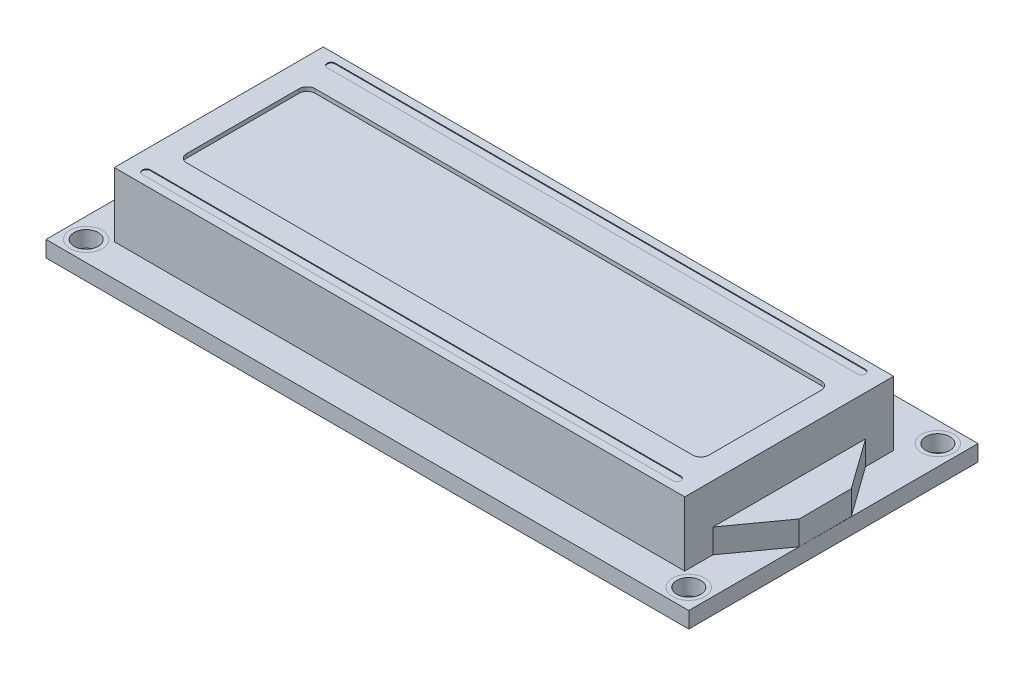
from build123d import *

# Parameters (mm, degrees)
SKETCH1_W           = 80
SKETCH1_H           = 36
BOSS_EXTRUDE1_DEPTH = 2
SKETCH2_R           = 1.5
CUT_EXTRUDE1_DEPTH  = 44.9089968
SKETCH3_W           = 71
SKETCH3_H           = 26
BOSS_EXTRUDE2_DEPTH = 8
CUT_EXTRUDE2_DEPTH  = 0.5
CUT_EXTRUDE3_DEPTH  = 0.1
BOSS_EXTRUDE3_DEPTH = 3
SKETCH10_R          = 0.5
CUT_EXTRUDE4_DEPTH  = 45.586993619


with BuildPart() as part:
    # Sketch1 → Boss-Extrude1 (new body)
    with BuildSketch(Plane(origin=(0, 0, 0), x_dir=(1, 0, 0), z_dir=(0, 1, 0))):
        Rectangle(SKETCH1_W, SKETCH1_H)
    extrude(amount=BOSS_EXTRUDE1_DEPTH)

    # Sketch2 → Cut-Extrude1 (cut, through all)
    with BuildSketch(Plane(origin=(0, 2, 0), x_dir=(1, 0, 0), z_dir=(0, 1, 0))):
        with Locations((-37.5, 15.5)):
            Circle(SKETCH2_R)
        with Locations((37.5, 15.5)):
            Circle(SKETCH2_R)
        with Locations((-37.5, -15.5)):
            Circle(SKETCH2_R)
        with Locations((37.5, -15.5)):
            Circle(SKETCH2_R)
    extrude(amount=-CUT_EXTRUDE1_DEPTH, mode=Mode.SUBTRACT)

    # Sketch3 → Boss-Extrude2 (add)
    with BuildSketch(Plane(origin=(0, 2, 0), x_dir=(1, 0, 0), z_dir=(0, 1, 0))):
        with Locations((0, -1)):
            Rectangle(SKETCH3_W, SKETCH3_H)
    extrude(amount=BOSS_EXTRUDE2_DEPTH)

    # Sketch5 → Cut-Extrude2 (cut)
    with BuildSketch(Plane(origin=(0, 10, 0), x_dir=(1, 0, 0), z_dir=(0, 1, 0))):
        with BuildLine():
            Line((-31.5, 7), (31.5, 7))
            ThreePointArc((31.5, 7), (32.207106781, 6.707106781), (32.5, 6))
            Line((32.5, 6), (32.5, -8))
            ThreePointArc((32.5, -8), (32.207106781, -8.707106781), (31.5, -9))
            Line((31.5, -9), (-31.5, -9))
            ThreePointArc((-31.5, -9), (-32.207106781, -8.707106781), (-32.5, -8))
            Line((-32.5, -8), (-32.5, 6))
            ThreePointArc((-32.5, 6), (-32.207106781, 6.707106781), (-31.5, 7))
        make_face()
    extrude(amount=-CUT_EXTRUDE2_DEPTH, mode=Mode.SUBTRACT)

    # Sketch6 → Cut-Extrude3 (cut)
    with BuildSketch(Plane(origin=(0, 10, 0), x_dir=(1, 0, 0), z_dir=(0, 1, 0))):
        with BuildLine():
            Line((33.01, 10), (-33.01, 10))
            ThreePointArc((-33.01, 10), (-33.356482323, 10.143517677), (-33.5, 10.49))
            Line((-33.5, 10.49), (-33.5, 10.51))
            ThreePointArc((-33.5, 10.51), (-33.356482323, 10.856482323), (-33.01, 11))
            Line((-33.01, 11), (33.01, 11))
            ThreePointArc((33.01, 11), (33.356482323, 10.856482323), (33.5, 10.51))
            Line((33.5, 10.51), (33.5, 10.49))
            ThreePointArc((33.5, 10.49), (33.356482323, 10.143517677), (33.01, 10))
        make_face()
        with BuildLine():
            Line((-33.5, -12.49), (-33.5, -12.51))
            ThreePointArc((-33.5, -12.51), (-33.356482323, -12.856482323), (-33.01, -13))
            Line((-33.01, -13), (33.01, -13))
            ThreePointArc((33.01, -13), (33.356482323, -12.856482323), (33.5, -12.51))
            Line((33.5, -12.51), (33.5, -12.49))
            ThreePointArc((33.5, -12.49), (33.356482323, -12.143517677), (33.01, -12))
            Line((33.01, -12), (-33.01, -12))
            ThreePointArc((-33.01, -12), (-33.356482323, -12.143517677), (-33.5, -12.49))
        make_face()
    extrude(amount=-CUT_EXTRUDE3_DEPTH, mode=Mode.SUBTRACT)

    # Sketch7 → Boss-Extrude3 (add)
    with BuildSketch(Plane(origin=(0, 2, 0), x_dir=(1, 0, 0), z_dir=(0, 1, 0))):
        Polygon((35.5, 8.5), (35.5, -10.5), (40, -4.249984615), (39.98, 2.249984615), align=None)
    extrude(amount=BOSS_EXTRUDE3_DEPTH)

    # Sketch10 → Cut-Extrude4 (cut, through all)
    with BuildSketch(Plane(origin=(0, 2, 0), x_dir=(1, 0, 0), z_dir=(0, 1, 0))):
        with Locations((-32, 16)):
            Circle(SKETCH10_R)
        with Locations((-29.5, 16)):
            Circle(SKETCH10_R)
        with Locations((-27, 16)):
            Circle(SKETCH10_R)
        with Locations((-24.5, 16)):
            Circle(SKETCH10_R)
        with Locations((-22, 16)):
            Circle(SKETCH10_R)
        with Locations((-19.5, 16)):
            Circle(SKETCH10_R)
        with Locations((-17, 16)):
            Circle(SKETCH10_R)
        with Locations((-14.5, 16)):
            Circle(SKETCH10_R)
        with Locations((-12, 16)):
            Circle(SKETCH10_R)
        with Locations((-9.5, 16)):
            Circle(SKETCH10_R)
        with Locations((-7, 16)):
            Circle(SKETCH10_R)
        with Locations((-4.5, 16)):
            Circle(SKETCH10_R)
        with Locations((-2, 16)):
            Circle(SKETCH10_R)
        with Locations((0.5, 16)):
            Circle(SKETCH10_R)
        with Locations((3, 16)):
            Circle(SKETCH10_R)
        with Locations((5.5, 16)):
            Circle(SKETCH10_R)
    extrude(amount=-CUT_EXTRUDE4_DEPTH, mode=Mode.SUBTRACT)


solid = part.part
